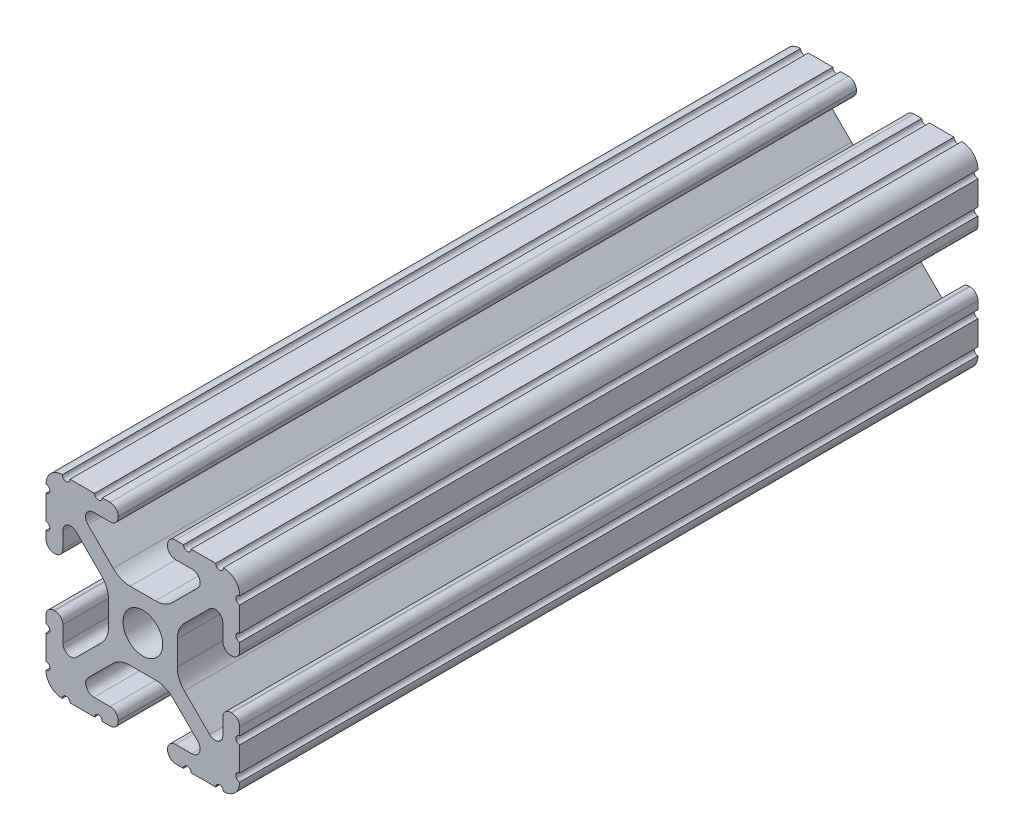
from build123d import *

# Parameters (mm, degrees)
SKETCH1_R               = 2.6035
BOSS_EXTRUDE1_DEPTH     = 457.2
CUT_EXTRUDE2_DEPTH      = 4.318
CUT_EXTRUDE2_DEPTH_BACK = 26.924
CUT_EXTRUDE3_DEPTH      = 459.081095441


with BuildPart() as part:
    # Sketch1 → Boss-Extrude1 (new, symmetric)
    with BuildSketch(Plane.XY):
        with BuildLine():
            Line((-7.179650497, -8.645192506), (-3.952270251, -5.423690499))
            ThreePointArc((-3.952270251, -5.423690499), (-2.922936451, -4.736929036), (-1.709253557, -4.4958))
            Line((-1.709253557, -4.4958), (1.709253557, -4.4958))
            ThreePointArc((1.709253557, -4.4958), (2.922936451, -4.736929036), (3.952270251, -5.423690499))
            Line((3.952270251, -5.423690499), (7.179650497, -8.645192506))
            ThreePointArc((7.179650497, -8.645192506), (7.41473083, -9.822813117), (6.416408329, -10.4902))
            Line((6.416408329, -10.4902), (4.287512407, -10.4902))
            ThreePointArc((4.287512407, -10.4902), (3.54574862, -10.79744862), (3.2385, -11.539212407))
            Line((3.2385, -11.539212407), (3.2385, -11.650987593))
            ThreePointArc((3.2385, -11.650987593), (3.54574862, -12.39275138), (4.287512407, -12.7))
            Line((4.287512407, -12.7), (5.317126718, -12.7))
            ThreePointArc((5.317126718, -12.7), (5.825126718, -12.192), (6.333126718, -12.7))
            Line((6.333126718, -12.7), (9.550443118, -12.7))
            ThreePointArc((9.550443118, -12.7), (10.058366869, -12.192000006), (10.566443095, -12.699847501))
            ThreePointArc((10.566443095, -12.699847501), (12.082537762, -12.08250727), (12.699846982, -10.566399977))
            ThreePointArc((12.699846982, -10.566399977), (12.192000006, -10.058323491), (12.7, -9.5504))
            Line((12.7, -9.5504), (12.7, -6.3330836))
            ThreePointArc((12.7, -6.3330836), (12.192, -5.8250836), (12.7, -5.3170836))
            Line((12.7, -5.3170836), (12.7, -4.287469289))
            ThreePointArc((12.7, -4.287469289), (12.39275138, -3.545705502), (11.650987593, -3.238456882))
            Line((11.650987593, -3.238456882), (11.539212407, -3.238456882))
            ThreePointArc((11.539212407, -3.238456882), (10.79744862, -3.545705502), (10.4902, -4.287469289))
            Line((10.4902, -4.287469289), (10.4902, -6.402089023))
            ThreePointArc((10.4902, -6.402089023), (9.856505071, -7.351067942), (8.737131347, -7.129408934))
            Line((8.737131347, -7.129408934), (5.441005833, -3.840816462))
            ThreePointArc((5.441005833, -3.840816462), (4.750877967, -2.809883091), (4.5085, -1.593185507))
            Line((4.5085, -1.593185507), (4.5085, 1.593185507))
            ThreePointArc((4.5085, 1.593185507), (4.750877967, 2.809883091), (5.441005833, 3.840816462))
            Line((5.441005833, 3.840816462), (8.737131347, 7.129408934))
            ThreePointArc((8.737131347, 7.129408934), (9.856505071, 7.351067942), (10.4902, 6.402089023))
            Line((10.4902, 6.402089023), (10.4902, 4.287469289))
            ThreePointArc((10.4902, 4.287469289), (10.79744862, 3.545705502), (11.539212407, 3.238456882))
            Line((11.539212407, 3.238456882), (11.650987593, 3.238456882))
            ThreePointArc((11.650987593, 3.238456882), (12.39275138, 3.545705502), (12.7, 4.287469289))
            Line((12.7, 4.287469289), (12.7, 5.3170836))
            ThreePointArc((12.7, 5.3170836), (12.192, 5.8250836), (12.7, 6.3330836))
            Line((12.7, 6.3330836), (12.7, 9.5504))
            ThreePointArc((12.7, 9.5504), (12.192000006, 10.058323491), (12.699846982, 10.566399977))
            ThreePointArc((12.699846982, 10.566399977), (12.082537762, 12.08250727), (10.566443095, 12.699847501))
            ThreePointArc((10.566443095, 12.699847501), (10.058366869, 12.192000006), (9.550443118, 12.7))
            Line((9.550443118, 12.7), (6.333126718, 12.7))
            ThreePointArc((6.333126718, 12.7), (5.825126718, 12.192), (5.317126718, 12.7))
            Line((5.317126718, 12.7), (4.287512407, 12.7))
            ThreePointArc((4.287512407, 12.7), (3.54574862, 12.39275138), (3.2385, 11.650987593))
            Line((3.2385, 11.650987593), (3.2385, 11.539212407))
            ThreePointArc((3.2385, 11.539212407), (3.54574862, 10.79744862), (4.287512407, 10.4902))
            Line((4.287512407, 10.4902), (6.476788598, 10.4902))
            ThreePointArc((6.476788598, 10.4902), (7.432222385, 9.85140422), (7.207036008, 8.724370562))
            Line((7.207036008, 8.724370562), (3.898272566, 5.423169045))
            ThreePointArc((3.898272566, 5.423169045), (2.869120213, 4.736787962), (1.655778399, 4.4958))
            Line((1.655778399, 4.4958), (-1.655778399, 4.4958))
            ThreePointArc((-1.655778399, 4.4958), (-2.869120213, 4.736787962), (-3.898272566, 5.423169045))
            Line((-3.898272566, 5.423169045), (-7.207036008, 8.724370562))
            ThreePointArc((-7.207036008, 8.724370562), (-7.432222385, 9.85140422), (-6.476788598, 10.4902))
            Line((-6.476788598, 10.4902), (-4.287512407, 10.4902))
            ThreePointArc((-4.287512407, 10.4902), (-3.54574862, 10.79744862), (-3.2385, 11.539212407))
            Line((-3.2385, 11.539212407), (-3.2385, 11.650987593))
            ThreePointArc((-3.2385, 11.650987593), (-3.54574862, 12.39275138), (-4.287512407, 12.7))
            Line((-4.287512407, 12.7), (-5.317126718, 12.7))
            ThreePointArc((-5.317126718, 12.7), (-5.825126718, 12.192), (-6.333126718, 12.7))
            Line((-6.333126718, 12.7), (-9.550443118, 12.7))
            ThreePointArc((-9.550443118, 12.7), (-10.058366869, 12.192000006), (-10.566443095, 12.699847501))
            ThreePointArc((-10.566443095, 12.699847501), (-12.082537762, 12.08250727), (-12.699846982, 10.566399977))
            ThreePointArc((-12.699846982, 10.566399977), (-12.192000006, 10.058323491), (-12.7, 9.5504))
            Line((-12.7, 9.5504), (-12.7, 6.3330836))
            ThreePointArc((-12.7, 6.3330836), (-12.192, 5.8250836), (-12.7, 5.3170836))
            Line((-12.7, 5.3170836), (-12.7, 4.287469289))
            ThreePointArc((-12.7, 4.287469289), (-12.39275138, 3.545705502), (-11.650987593, 3.238456882))
            Line((-11.650987593, 3.238456882), (-11.539212407, 3.238456882))
            ThreePointArc((-11.539212407, 3.238456882), (-10.79744862, 3.545705502), (-10.4902, 4.287469289))
            Line((-10.4902, 4.287469289), (-10.4902, 6.402089023))
            ThreePointArc((-10.4902, 6.402089023), (-9.856505071, 7.351067942), (-8.737131347, 7.129408934))
            Line((-8.737131347, 7.129408934), (-5.441005833, 3.840816462))
            ThreePointArc((-5.441005833, 3.840816462), (-4.750877967, 2.809883091), (-4.5085, 1.593185507))
            Line((-4.5085, 1.593185507), (-4.5085, -1.593185507))
            ThreePointArc((-4.5085, -1.593185507), (-4.750877967, -2.809883091), (-5.441005833, -3.840816462))
            Line((-5.441005833, -3.840816462), (-8.737131347, -7.129408934))
            ThreePointArc((-8.737131347, -7.129408934), (-9.856505071, -7.351067942), (-10.4902, -6.402089023))
            Line((-10.4902, -6.402089023), (-10.4902, -4.287469289))
            ThreePointArc((-10.4902, -4.287469289), (-10.79744862, -3.545705502), (-11.539212407, -3.238456882))
            Line((-11.539212407, -3.238456882), (-11.650987593, -3.238456882))
            ThreePointArc((-11.650987593, -3.238456882), (-12.39275138, -3.545705502), (-12.7, -4.287469289))
            Line((-12.7, -4.287469289), (-12.7, -5.3170836))
            ThreePointArc((-12.7, -5.3170836), (-12.192, -5.8250836), (-12.7, -6.3330836))
            Line((-12.7, -6.3330836), (-12.7, -9.5504))
            ThreePointArc((-12.7, -9.5504), (-12.192000006, -10.058323491), (-12.699846982, -10.566399977))
            ThreePointArc((-12.699846982, -10.566399977), (-12.082537762, -12.08250727), (-10.566443095, -12.699847501))
            ThreePointArc((-10.566443095, -12.699847501), (-10.058366869, -12.192000006), (-9.550443118, -12.7))
            Line((-9.550443118, -12.7), (-6.333126718, -12.7))
            ThreePointArc((-6.333126718, -12.7), (-5.825126718, -12.192), (-5.317126718, -12.7))
            Line((-5.317126718, -12.7), (-4.287512407, -12.7))
            ThreePointArc((-4.287512407, -12.7), (-3.54574862, -12.39275138), (-3.2385, -11.650987593))
            Line((-3.2385, -11.650987593), (-3.2385, -11.539212407))
            ThreePointArc((-3.2385, -11.539212407), (-3.54574862, -10.79744862), (-4.287512407, -10.4902))
            Line((-4.287512407, -10.4902), (-6.416408329, -10.4902))
            ThreePointArc((-6.416408329, -10.4902), (-7.41473083, -9.822813117), (-7.179650497, -8.645192506))
        make_face()
        Circle(SKETCH1_R, mode=Mode.SUBTRACT)
    extrude(amount=BOSS_EXTRUDE1_DEPTH, both=True)

    # Sketch3 → Cut-Extrude2 (cut, two sides: drawn at the far end of the back side and taken through both)
    with BuildSketch(Plane.ZY.offset(12.7).offset(-CUT_EXTRUDE2_DEPTH_BACK)):
        Polygon((-203.2, -27.552777595), (-203.2, 21.158109763), (-461.090893327, 21.158109763), (-461.090893327, -25.4), align=None)
    extrude(amount=CUT_EXTRUDE2_DEPTH + CUT_EXTRUDE2_DEPTH_BACK, mode=Mode.SUBTRACT)

    # Sketch4 → Cut-Extrude3 (cut, through all)
    with BuildSketch(Plane(origin=(12.7, 0, 0), x_dir=(0, 0, -1), z_dir=(1, 0, 0))):
        Polygon((106.406754823, 13.989853394), (106.406754823, -36.629490115), (-460.158503809, -34.133289118), (-460.158503809, 13.989853394), align=None)
    extrude(amount=-CUT_EXTRUDE3_DEPTH, mode=Mode.SUBTRACT)


solid = part.part
